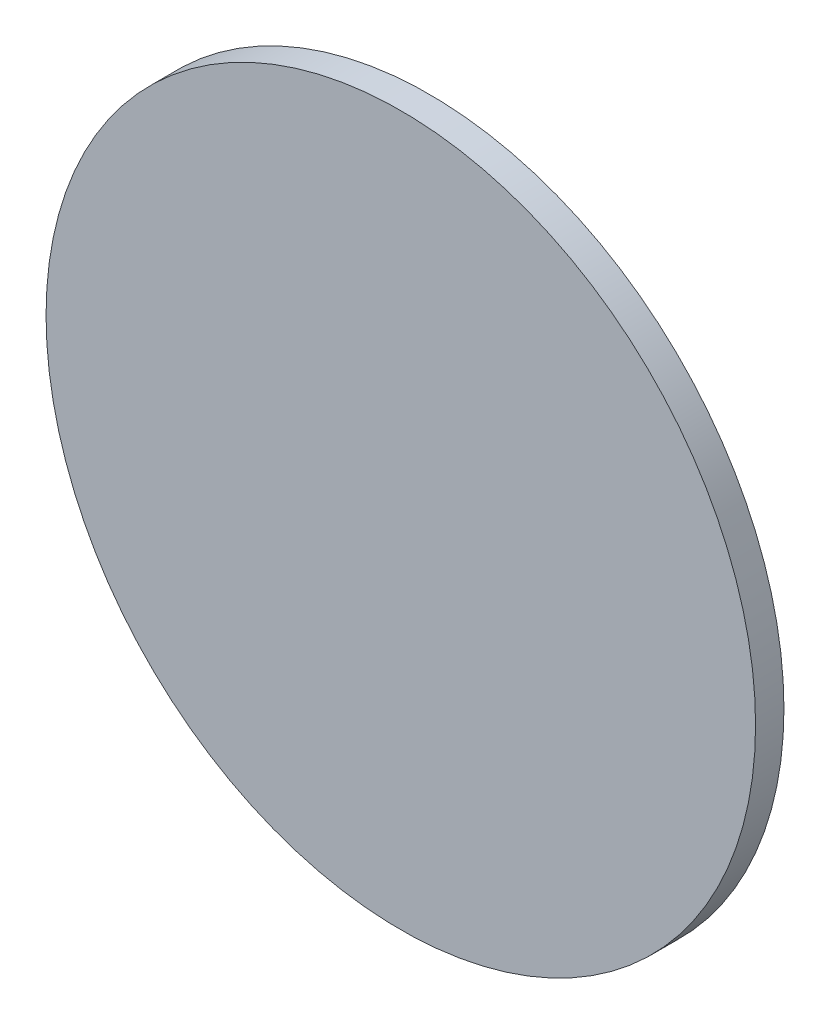
from build123d import *


with BuildPart() as part:
    # Sketch2 → Revolve1 (revolve)
    with BuildSketch(Plane(origin=(0, 0, 0), x_dir=(1, 0, 0), z_dir=(0, 1, 0))):
        Polygon((0, 0), (0, 5), (39.45, 5), (39.45, 2), (44.95, 2), (44.95, 5), (50.5, 5), (50.5, 2), (57.5, 2), (57.5, 5), (62.5, 5), (62.5, 0), align=None)
    revolve(axis=Axis((0, 0, 0), (0, 0, 1)))


solid = part.part
